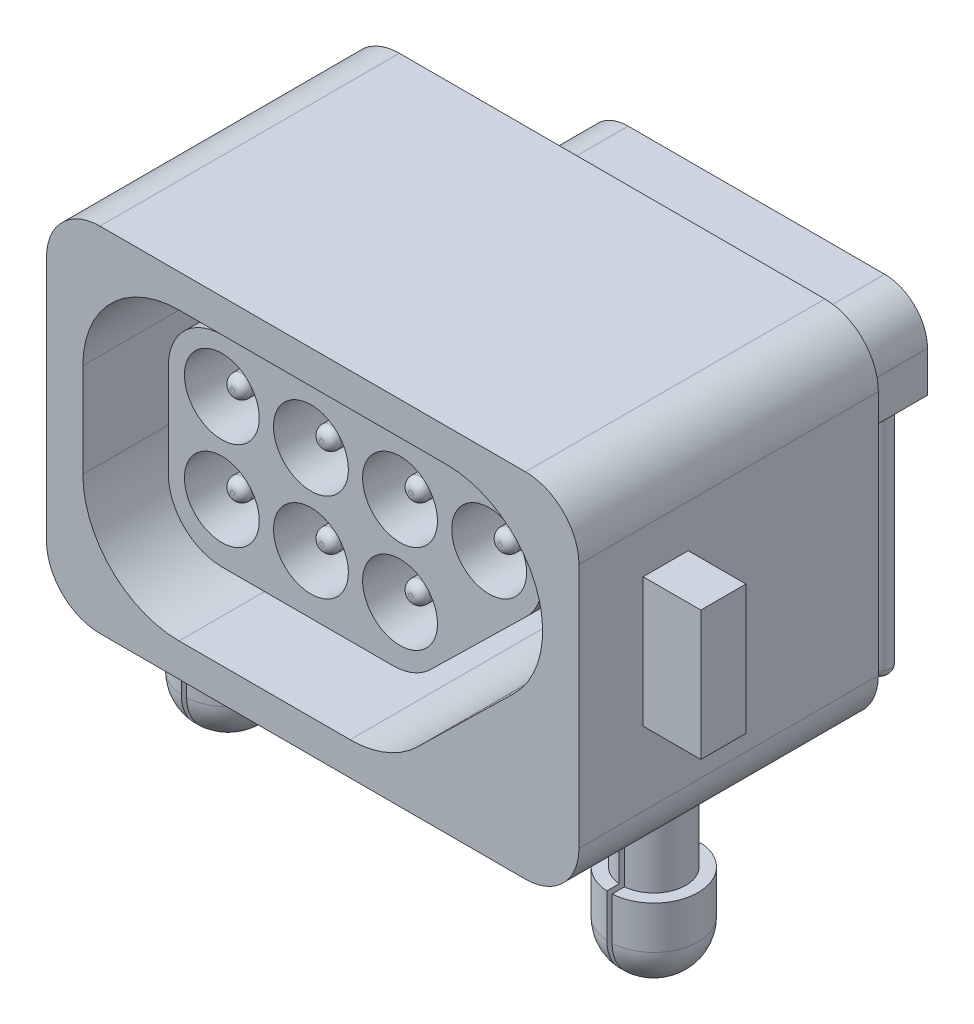
from build123d import *

# Parameters (mm, degrees)
SKETCH1_W            = 24.9
SKETCH1_H            = 16.5
BOSS_EXTRUDE1_DEPTH  = 14
FILLET1_R            = 2.5
SKETCH2_W            = 2.11
SKETCH2_H            = 6.05
BOSS_EXTRUDE2_DEPTH  = 2.7
BOSS_EXTRUDE3_START  = -6.5
SKETCH3_R            = 1.5
BOSS_EXTRUDE3_DEPTH  = 9
SKETCH4_R            = 2.075
BOSS_EXTRUDE4_DEPTH  = 4
FILLET2_R            = 2
SKETCH5_W            = 0.25
SKETCH5_H            = 4.512360642
CUT_EXTRUDE2_DEPTH   = 6
CUT_EXTRUDE3_DEPTH   = 12.5
BOSS_EXTRUDE5_DEPTH  = 10.5
SKETCH8_R            = 1.75
CUT_EXTRUDE4_DEPTH   = 10
SKETCH9_R            = 0.5
BOSS_EXTRUDE6_DEPTH  = 9.5
LPATTERN1_COUNT      = 4
LPATTERN1_PITCH      = 4.166666667
LPATTERN1_COUNT_DIR2 = 2
LPATTERN1_PITCH_DIR2 = 4.166666667
SKETCH12_W           = 16
SKETCH12_H           = 3.9
BOSS_EXTRUDE7_DEPTH  = 6.75
FILLET3_R            = 2
SKETCH13_W           = 12
SKETCH13_H           = 4.42
BOSS_EXTRUDE8_DEPTH  = 4
FILLET4_R            = 2
SKETCH15_R           = 0.5
BOSS_EXTRUDE9_DEPTH  = 11.85
LPATTERN2_COUNT      = 4
LPATTERN2_PITCH      = 4.166666667
LPATTERN2_COUNT_DIR2 = 2
LPATTERN2_PITCH_DIR2 = 4.166666667
LPATTERN3_COUNT      = 4
LPATTERN3_PITCH      = 4.166666667
LPATTERN3_COUNT_DIR2 = 2
LPATTERN3_PITCH_DIR2 = 4.166666667
FILLET5_R            = 0.4


# Read off the part's stored shape, not the designer's step: Mirror1
with BuildPart() as part:
    # Sketch1 → Boss-Extrude1 (new body)
    with BuildSketch(Plane.XY):
        Rectangle(SKETCH1_W, SKETCH1_H)
    extrude(amount=BOSS_EXTRUDE1_DEPTH)

    # Fillet1
    fillet1_edges = [part.edges().sort_by_distance(p)[0] for p in [
        (12.45, -8.25, 7),
        (-12.45, -8.25, 7),
        (-12.45, 8.25, 7),
        (12.45, 8.25, 7),
    ]]
    fillet(fillet1_edges, radius=FILLET1_R)

    # Sketch2 → Boss-Extrude2 (add)
    with BuildSketch(Plane(origin=(12.45, 0, 0), x_dir=(0, 0, -1), z_dir=(1, 0, 0))):
        with Locations((-9.945, 0.725)):
            Rectangle(SKETCH2_W, SKETCH2_H)
    extrude(amount=BOSS_EXTRUDE2_DEPTH)

    # Sketch3 → Boss-Extrude3 (add)
    with BuildSketch(Plane.XZ.offset(8.25).offset(BOSS_EXTRUDE3_START)):
        with Locations(Location((9.95, 8, 0), (0, 0, 270))):
            Circle(SKETCH3_R)
    extrude(amount=BOSS_EXTRUDE3_DEPTH)

    # Sketch4 → Boss-Extrude4 (add)
    with BuildSketch(Plane.XZ.offset(10.75)):
        with Locations(Location((9.95, 8, 0), (0, 0, 270))):
            Circle(SKETCH4_R)
    extrude(amount=BOSS_EXTRUDE4_DEPTH)

    # Fillet2
    fillet2_edges = [part.edges().sort_by_distance(p)[0] for p in [
        (9.95, -14.75, 10.075),
    ]]
    fillet(fillet2_edges, radius=FILLET2_R)

    # Sketch5 → Cut-Extrude2 (cut)
    with BuildSketch(Plane.XZ.offset(14.75)):
        with Locations((9.95, 8)):
            Rectangle(SKETCH5_W, SKETCH5_H)
    extrude(amount=-CUT_EXTRUDE2_DEPTH, mode=Mode.SUBTRACT)

    # Mirror1: part across plane


with BuildPart() as part_1:
    add(part.part)
    add(part.part.mirror(Plane(origin=(0, 0, 0), x_dir=(0, 0, 1), z_dir=(1, 0, 0))))

    # Sketch6 → Cut-Extrude3 (cut)
    with BuildSketch(Plane.XY.offset(14)):
        with BuildLine():
            Line((-6.25, 6.7), (6.25, 6.7))
            ThreePointArc((6.25, 6.7), (10.417066417, 3.898692873), (9.396029344, -1.017530011))
            Line((9.396029344, -1.017530011), (4.896029344, -5.417530011))
            ThreePointArc((4.896029344, -5.417530011), (3.448692873, -6.367066417), (1.75, -6.7))
            Line((1.75, -6.7), (-6.25, -6.7))
            ThreePointArc((-6.25, -6.7), (-9.431980515, -5.381980515), (-10.75, -2.2))
            Line((-10.75, -2.2), (-10.75, 2.2))
            ThreePointArc((-10.75, 2.2), (-9.431980515, 5.381980515), (-6.25, 6.7))
        make_face()
    extrude(amount=-CUT_EXTRUDE3_DEPTH, mode=Mode.SUBTRACT)

    # Sketch7 → Boss-Extrude5 (add)
    with BuildSketch(Plane.XY.offset(1.5)):
        with BuildLine():
            Line((3.49779408, -3.987516673), (7.99779408, 0.412483327))
            ThreePointArc((7.99779408, 0.412483327), (8.565036898, 3.143718263), (6.25, 4.7))
            Line((6.25, 4.7), (-6.25, 4.7))
            ThreePointArc((-6.25, 4.7), (-8.017766953, 3.967766953), (-8.75, 2.2))
            Line((-8.75, 2.2), (-8.75, -2.2))
            ThreePointArc((-8.75, -2.2), (-8.017766953, -3.967766953), (-6.25, -4.7))
            Line((-6.25, -4.7), (1.75, -4.7))
            ThreePointArc((1.75, -4.7), (2.693718263, -4.515036898), (3.49779408, -3.987516673))
        make_face()
    extrude(amount=BOSS_EXTRUDE5_DEPTH)

    # Sketch8 → Cut-Extrude4 (cut)
    with BuildSketch(Plane.XY.offset(12)):
        with Locations((-6.25, 2.2)):
            Circle(SKETCH8_R)
    cut_extrude4 = extrude(amount=-CUT_EXTRUDE4_DEPTH, mode=Mode.SUBTRACT)

    # Sketch9 → Boss-Extrude6 (add)
    with BuildSketch(Plane.XY.offset(2)):
        with Locations((-6.25, 2.2)):
            Circle(SKETCH9_R)
    boss_extrude6 = extrude(amount=BOSS_EXTRUDE6_DEPTH)

    # LPattern1: Cut-Extrude4 4 × 2, 1 skipped
    with Locations(*[(i * LPATTERN1_PITCH, -j * LPATTERN1_PITCH_DIR2, 0) for i in range(LPATTERN1_COUNT) for j in range(LPATTERN1_COUNT_DIR2) if (i, j) not in ((0, 0), (3, 1))]):
        add(cut_extrude4, mode=Mode.SUBTRACT)

    # Sketch12 → Boss-Extrude7 (add)
    with BuildSketch(Plane(origin=(0, 0, 0), x_dir=(-1, 0, 0), z_dir=(0, 0, -1))):
        with Locations((0, 1.95)):
            Rectangle(SKETCH12_W, SKETCH12_H)
    extrude(amount=BOSS_EXTRUDE7_DEPTH)

    # Fillet3
    fillet3_edges = [part_1.edges().sort_by_distance(p)[0] for p in [
        (8, 3.9, -3.375),
        (-8, 3.9, -3.375),
    ]]
    fillet(fillet3_edges, radius=FILLET3_R)

    # Sketch13 → Boss-Extrude8 (add)
    with BuildSketch(Plane(origin=(0, 0, 0), x_dir=(-1, 0, 0), z_dir=(0, 0, -1))):
        with Locations((2, -2.21)):
            Rectangle(SKETCH13_W, SKETCH13_H)
    extrude(amount=BOSS_EXTRUDE8_DEPTH)

    # Fillet4
    fillet4_edges = [part_1.edges().sort_by_distance(p)[0] for p in [
        (-8, -4.42, -2),
        (4, -4.42, -2),
    ]]
    fillet(fillet4_edges, radius=FILLET4_R)

    # Sketch15 → Boss-Extrude9 (add)
    with BuildSketch(Plane.XZ):
        with Locations(Location((-6.25, -6.25, 0), (0, 0, 270))):
            Circle(SKETCH15_R)
    boss_extrude9 = extrude(amount=BOSS_EXTRUDE9_DEPTH)

    # LPattern2: Boss-Extrude9 4 × 2, 1 skipped
    with Locations(*[(i * LPATTERN2_PITCH, 0, j * LPATTERN2_PITCH_DIR2) for i in range(LPATTERN2_COUNT) for j in range(LPATTERN2_COUNT_DIR2) if (i, j) not in ((0, 0), (3, 1))]):
        add(boss_extrude9)

    # LPattern3: Boss-Extrude6 4 × 2, 1 skipped
    with Locations(*[(i * LPATTERN3_PITCH, -j * LPATTERN3_PITCH_DIR2, 0) for i in range(LPATTERN3_COUNT) for j in range(LPATTERN3_COUNT_DIR2) if (i, j) not in ((0, 0), (3, 1))]):
        add(boss_extrude6)

    # Fillet5
    fillet5_edges = [part_1.edges().sort_by_distance(p)[0] for p in [
        (-6.75, 2.2, 11.5),
        (-6.25, -11.85, -5.75),
        (-6.25, -11.85, -1.583333333),
        (-2.083333333, -11.85, -5.75),
        (-2.083333333, -11.85, -1.583333333),
        (2.083333333, -11.85, -5.75),
        (2.083333333, -11.85, -1.583333333),
        (6.25, -11.85, -5.75),
        (-6.75, -1.966666667, 11.5),
        (-2.583333333, 2.2, 11.5),
        (-2.583333333, -1.966666667, 11.5),
        (1.583333333, 2.2, 11.5),
        (1.583333333, -1.966666667, 11.5),
        (5.75, 2.2, 11.5),
    ]]
    fillet(fillet5_edges, radius=FILLET5_R)


solid = part_1.part
